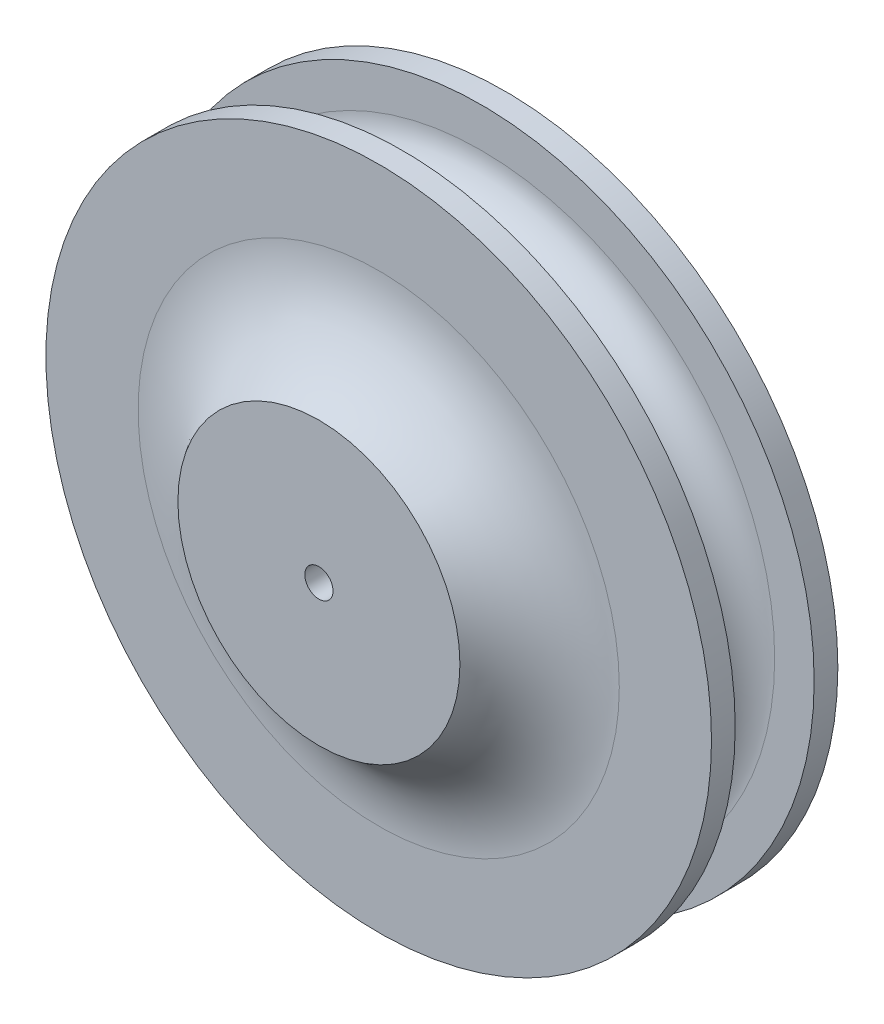
from build123d import *

# Parameters (mm, degrees)
BOSS_EXTRUDE1_DEPTH      = 3.556
BOSS_EXTRUDE1_DEPTH_BACK = 3.556
SKETCH2_R                = 18.7325
BOSS_EXTRUDE2_DEPTH      = 6.9215
BOSS_EXTRUDE2_DEPTH_BACK = 6.9215
SKETCH4_R                = 7.9375
FILLET1_R                = 6.35
CUT_EXTRUDE1_DEPTH       = 30.890496174
CUT_EXTRUDE1_DEPTH_BACK  = 30.890496174
SKETCH5_R                = 0.79375


with BuildPart() as part:
    # Sketch2 → Boss-Extrude1 (new, two sides: drawn at the far end of the back side and taken through both)
    with BuildSketch(Plane.XY.offset(-BOSS_EXTRUDE1_DEPTH_BACK)):
        Circle(SKETCH2_R)
    extrude(amount=BOSS_EXTRUDE1_DEPTH + BOSS_EXTRUDE1_DEPTH_BACK)

    # Sketch3 → Cut-Revolve1 (revolve, cut)
    with BuildSketch(Plane(origin=(0, 0, 0), x_dir=(0, 0, -1), z_dir=(1, 0, 0)), mode=Mode.PRIVATE) as cut_revolve1_sk:
        with BuildLine():
            Line((-2.2225, 16.51), (-2.2225, 20.955))
            Line((-2.2225, 20.955), (2.2225, 20.955))
            Line((2.2225, 20.955), (2.2225, 16.51))
            ThreePointArc((2.2225, 16.51), (0, 14.2875), (-2.2225, 16.51))
        make_face()
    revolve(cut_revolve1_sk.sketch.rotate(Axis((0, 0, 3.556), (0, 0, -1)), 90), axis=Axis((0, 0, 3.556), (0, 0, -1)), mode=Mode.SUBTRACT)

    # Sketch4 → Boss-Extrude2 (add, two sides: drawn at the far end of the back side and taken through both)
    with BuildSketch(Plane.XY.offset(-BOSS_EXTRUDE2_DEPTH_BACK)):
        Circle(SKETCH4_R)
    extrude(amount=BOSS_EXTRUDE2_DEPTH + BOSS_EXTRUDE2_DEPTH_BACK)

    # Fillet1
    # the kernel refuses this fillet: 6.35 mm, written as the material it adds along each edge
    with BuildSketch(Plane(origin=(0, 0, 3.556), x_dir=(1, 0, 0), z_dir=(0, 1, 0))) as fillet1_piece_1:
        with BuildLine():
            CenterArc((13.542431735, -6.35), FILLET1_R, 90, 61.965703465)
            Line((7.9375, -3.3655), (7.825401365, -3.30581))
            ThreePointArc((7.825401365, -3.30581), (7.8105, -1.68275), (7.8105, 0))
            Line((7.8105, 0), (7.9375, 0.127))
            Line((7.9375, 0.127), (13.542431735, 0.127))
            Line((13.542431735, 0.127), (13.542431735, 0))
        make_face()
    revolve(axis=Axis((0, 0, 3.556), (0, 0, -1)))
    with BuildSketch(Plane(origin=(0, 0, -3.556), x_dir=(1, 0, 0), z_dir=(0, -1, 0))) as fillet1_piece_2:
        with BuildLine():
            CenterArc((13.542431735, -6.35), FILLET1_R, 90, 61.965703465)
            Line((7.9375, -3.3655), (7.825401365, -3.30581))
            ThreePointArc((7.825401365, -3.30581), (7.8105, -1.68275), (7.8105, 0))
            Line((7.8105, 0), (7.9375, 0.127))
            Line((7.9375, 0.127), (13.542431735, 0.127))
            Line((13.542431735, 0.127), (13.542431735, 0))
        make_face()
    revolve(axis=Axis((0, 0, -3.556), (0, 0, 1)))

    # Sketch5 → Cut-Extrude1 (cut, two sides: drawn at the far end of the back side and taken through both)
    with BuildSketch(Plane.XY.offset(6.9215).offset(-CUT_EXTRUDE1_DEPTH_BACK)):
        Circle(SKETCH5_R)
    extrude(amount=CUT_EXTRUDE1_DEPTH + CUT_EXTRUDE1_DEPTH_BACK, mode=Mode.SUBTRACT)


solid = part.part
